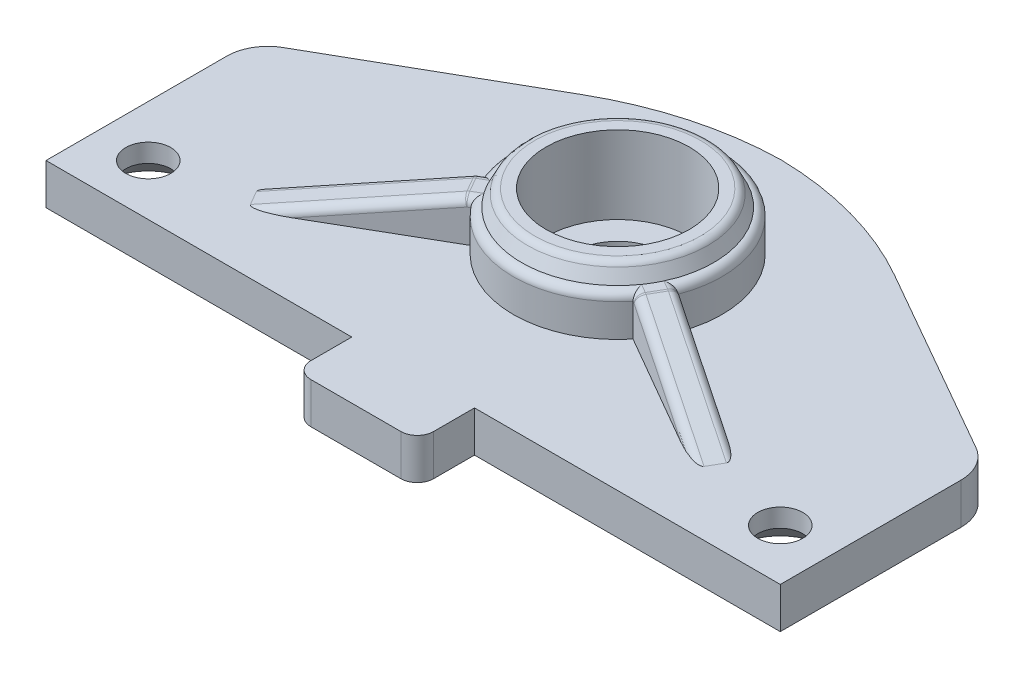
from build123d import *
from OCP.BRepFilletAPI import BRepFilletAPI_MakeChamfer

# Parameters (mm, degrees)
SKETCH_1_R                  = 3.5
EXTRUDE_1_DEPTH             = 2
FILLET_1_R                  = 2
FILLET_2_R                  = 16
SKETCH_2_R                  = 5.1000000000000005
SKETCH_2_R_2                = 3.5
EXTRUDE_2_DEPTH             = 2
SKETCH_3_R                  = 3.5
SKETCH_3_R_2                = 2.2
EXTRUDE_3_DEPTH             = 1
EXTRUDE_4_DEPTH             = 2
CHAMFER_1_SIZE              = 7.8
CHAMFER_1_SIZE_2            = 2
FILLET_3_R                  = 0.4
HOLE_WIZARD_M21_D           = 2.2
HOLE_WIZARD_M21_CSINK_D     = 4.4
HOLE_WIZARD_M21_CSINK_ANGLE = 90
EXTRUDE_5_DEPTH             = 2.8
FILLET_4_R                  = 0.8
SKETCH_11_R                 = 4.3
SKETCH_11_R_2               = 3.5
EXTRUDE_6_DEPTH             = 0.8
CHAMFER_2_SIZE2             = 0.8
CHAMFER_2_SIZE              = 0.4


with BuildPart() as part:
    # Эскиз1 → Бобышка-Вытянуть1 (new body)
    with BuildSketch(Plane(origin=(0, 0, 0), x_dir=(1, 0, 0), z_dir=(0, 1, 0))):
        Polygon((-17.95, 2.0000000000000018), (-3.950000000000008, 10), (3.9499999999999997, 10), (17.95, 2.0000000000000018), (17.949999999999996, -7.999999999999998), (-17.950000000000006, -7.999999999999998), align=None)
        with Locations(Location((0, 2.0000000000000018, 0), (0, 0, 270))):
            Circle(SKETCH_1_R, mode=Mode.SUBTRACT)
    extrude(amount=EXTRUDE_1_DEPTH)

    # Скругление1
    fillet_1_edges = [part.edges().sort_by_distance(p)[0] for p in [
        (-17.95, 1, -2.0000000000000018),
        (17.95, 1, -2.0000000000000018),
    ]]
    fillet(fillet_1_edges, radius=FILLET_1_R)

    # Скругление2
    # the kernel refuses this fillet: 16 mm, written as the material it takes off along each edge
    with BuildSketch(Plane(origin=(3.9499999999999997, -10.622577482985493, -10), x_dir=(-1, 0, 0), z_dir=(0, 1, 0))) as fillet_2_piece_1:
        with BuildLine():
            CenterArc((FILLET_2_R * 0.265564437075, FILLET_2_R), FILLET_2_R, 240.25511870305778, 29.744881296942253)
            Line((-FILLET_2_R * 0.230574501282, FILLET_2_R * 0.131756857876), (0, 0))
            Line((0, 0), (FILLET_2_R * 0.265564437075, 0))
        make_face()
    extrude(amount=23.245154965970986, mode=Mode.SUBTRACT)
    with BuildSketch(Plane(origin=(-3.950000000000008, -10.6225774829855, -10), x_dir=(-0.8682431421244592, 0, 0.496138938356834), z_dir=(0, 1, 0))) as fillet_2_piece_2:
        with BuildLine():
            CenterArc((FILLET_2_R * 0.265564437075, FILLET_2_R), FILLET_2_R, 240.25511870305778, 29.744881296942253)
            Line((-FILLET_2_R * 0.230574501282, FILLET_2_R * 0.131756857876), (0, 0))
            Line((0, 0), (FILLET_2_R * 0.265564437075, 0))
        make_face()
    extrude(amount=23.245154965971, mode=Mode.SUBTRACT)

    # Эскиз2 → Бобышка-Вытянуть2 (add)
    with BuildSketch(Plane(origin=(0, 2, 0), x_dir=(1, 0, 0), z_dir=(0, 1, 0))):
        with Locations(Location((0, 2.0000000000000018, 0), (0, 0, 270))):
            Circle(SKETCH_2_R)
        with Locations(Location((0, 2.0000000000000018, 0), (0, 0, 270))):
            Circle(SKETCH_2_R_2, mode=Mode.SUBTRACT)
    extrude(amount=EXTRUDE_2_DEPTH)

    # Эскиз3 → Бобышка-Вытянуть3 (add)
    with BuildSketch(Plane.XZ):
        with Locations(Location((0, -2.0000000000000018, 0), (0, 0, 270))):
            Circle(SKETCH_3_R)
        with Locations(Location((0, -2.0000000000000018, 0), (0, 0, 270))):
            Circle(SKETCH_3_R_2, mode=Mode.SUBTRACT)
    extrude(amount=-EXTRUDE_3_DEPTH)

    # Эскиз4 → Бобышка-Вытянуть4 (add)
    with BuildSketch(Plane(origin=(0, 2, 0), x_dir=(1, 0, 0), z_dir=(0, 1, 0))):
        Polygon((-4.762052269287931, 0.1743882711349406), (-11.690255499563435, -3.8256117288650744), (-10.890255499563432, -5.211252374920172), (-3.962052269287929, -1.21125237492016), align=None)
        Polygon((10.890255499563436, -5.21125237492017), (3.9620522692879283, -1.2112523749201598), (4.762052269287931, 0.17438827113494176), (11.690255499563435, -3.8256117288650713), align=None)
    extrude(amount=EXTRUDE_4_DEPTH)

    # Фаска1
    chamfer_1_edges_1 = [part.edges().sort_by_distance(p)[0] for p in [
        (11.290255499563436, 4, 4.518432051892621),
    ]]
    chamfer_1_side_1 = [part.faces().sort_by_distance(p)[0] for p in [
        (11.255614483412058, 4, 4.498432051892621),
    ]]
    chamfer_1_edges_2 = [part.edges().sort_by_distance(p)[0] for p in [
        (-11.290255499563433, 4, 4.518432051892623),
    ]]
    chamfer_1_side_2 = [part.faces().sort_by_distance(p)[0] for p in [
        (-11.290255499563433, 3.96, 4.518432051892623),
    ]]
    chamfer_1 = BRepFilletAPI_MakeChamfer(part.part.solid().wrapped)
    for e in chamfer_1_edges_1:
        chamfer_1.Add(CHAMFER_1_SIZE - 0.0001, CHAMFER_1_SIZE_2 - 0.0001, e.wrapped, chamfer_1_side_1[0].wrapped)
    for e in chamfer_1_edges_2:
        chamfer_1.Add(CHAMFER_1_SIZE_2 - 0.0001, CHAMFER_1_SIZE - 0.0001, e.wrapped, chamfer_1_side_2[0].wrapped)
    add(Compound.cast(chamfer_1.Shape()), mode=Mode.REPLACE)  # a hair under: the kernel refuses the full size

    # Скругление3
    fillet_3_edges = [part.edges().sort_by_distance(p)[0] for p in [
        (-4.4e-16, 4, 3.0999999999999996),
        (-4.848698110936565, 4, -0.12436327113493996),
        (1.56e-15, 4, -7.100000000000002),
        (4.048698110936562, 4, 1.2612773749201605),
        (4.8486981109365646, 4, -0.12436327113494133),
        (-4.048698110936562, 4, 1.2612773749201596),
        (-4.5353439525851975, 4, 0.6184820518926107),
        (4.5353439525851975, 4, 0.6184820518926104),
        (8.312799726074315, 3.00005, 1.8756367288650657),
        (7.512799726074316, 3.0000500000000003, 3.261277374920165),
        (-7.512799726074315, 3.0000499999999994, 3.2612773749201676),
        (-8.312799726074317, 3.00005, 1.8756367288650682),
    ]]
    fillet(fillet_3_edges, radius=FILLET_3_R)

    # Зенковка для винта с полупотайной головкой M21 (through all)
    with Locations(Plane(origin=(0, 0, 0), x_dir=(-1, 0, 0), z_dir=(0, -1, 0))):
        with Locations((-15.45, -5.5), (15.45, -5.5)):
            CounterSinkHole(HOLE_WIZARD_M21_D / 2, HOLE_WIZARD_M21_CSINK_D / 2, counter_sink_angle=HOLE_WIZARD_M21_CSINK_ANGLE)

    # Эскиз10 → Бобышка-Вытянуть5 (add)
    with BuildSketch(Plane.XY.offset(7.999999999999998)):
        Polygon((-3.0000000000000044, 2), (2.9999999999999956, 2), (2.9999999999999956, 0), (-3.0000000000000036, 0), align=None)
    extrude(amount=EXTRUDE_5_DEPTH)

    # Скругление4
    fillet_4_edges = [part.edges().sort_by_distance(p)[0] for p in [
        (-3.000000000000004, 1, 10.799999999999997),
        (2.9999999999999956, 1, 10.799999999999997),
    ]]
    fillet(fillet_4_edges, radius=FILLET_4_R)

    # Эскиз11 → Бобышка-Вытянуть6 (add)
    with BuildSketch(Plane(origin=(0, 4, 0), x_dir=(1, 0, 0), z_dir=(0, 1, 0))):
        with Locations(Location((0, 2.0000000000000018, 0), (0, 0, 270))):
            Circle(SKETCH_11_R)
        with Locations(Location((0, 2.0000000000000018, 0), (0, 0, 90))):
            Circle(SKETCH_11_R_2, mode=Mode.SUBTRACT)
    extrude(amount=EXTRUDE_6_DEPTH)

    # Фаска2
    chamfer_2_edges = [part.edges().sort_by_distance(p)[0] for p in [
        (1.32e-15, 4, -6.300000000000002),
    ]]
    chamfer_2_side = [part.faces().sort_by_distance(p)[0] for p in [
        (1.32e-15, 4, -6.308000000000002),
    ]]
    chamfer(chamfer_2_edges, length=CHAMFER_2_SIZE - 0.0001, length2=CHAMFER_2_SIZE2 - 0.0001, reference=chamfer_2_side[0])  # a hair under: the kernel refuses the full size

    # Скругление5: read off the stored shape, not the designer's step
    # Скругление5 outline → Скругление5 (revolve, cut)
    with BuildSketch(Plane.XY.offset(-2)):
        with BuildLine():
            ThreePointArc((4.052786405, 4.8), (4.263078849, 4.740260323), (4.410557281, 4.578885438))
            Line((4.410557281, 4.578885438), (4.410557281, 4.8))
            Line((4.410557281, 4.8), (4.052786405, 4.8))
        make_face()
    revolve(axis=Axis((0, 0, -2), (0, 1, 0)), mode=Mode.SUBTRACT)


solid = part.part
